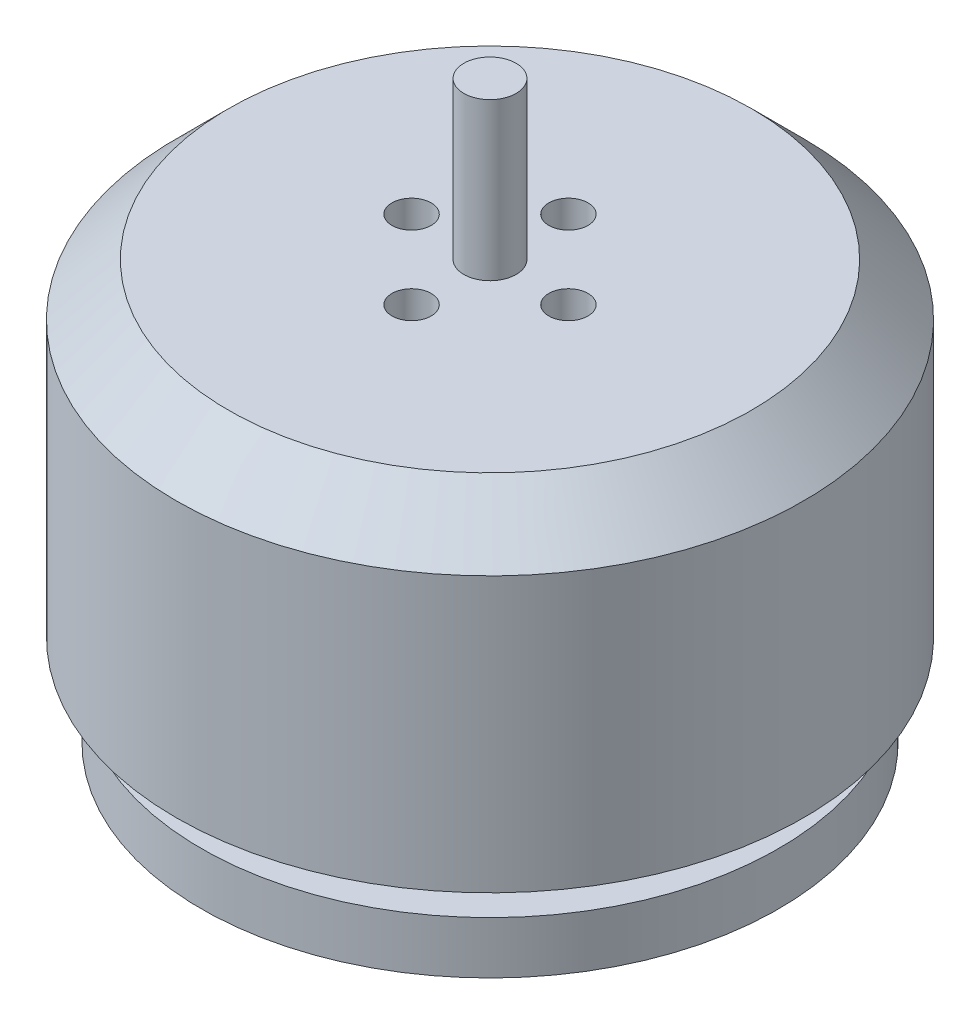
from build123d import *

# Parameters (mm, degrees)
SKETCH2_R          = 1.5
CUT_EXTRUDE1_DEPTH = 3.3
SKETCH3_R          = 1.5
CUT_EXTRUDE2_DEPTH = 8


with BuildPart() as part:
    # Sketch1 → Revolve1 (revolve)
    with BuildSketch(Plane.XY):
        Polygon((0, 0), (22.08, 0), (22.08, 4), (16.8, 4), (16.8, 7), (24, 7), (24, 28), (20, 32), (2, 32), (2, 44), (0, 44), align=None)
    revolve(axis=Axis((0, -10, 0), (0, 1, 0)))

    # Sketch2 → Cut-Extrude1 (cut)
    with BuildSketch(Plane(origin=(0, 0, 0), x_dir=(1, 0, 0), z_dir=(0, 1, 0))):
        with Locations((8.84, -8.84)):
            Circle(SKETCH2_R)
        with Locations((8.84, 8.84)):
            Circle(SKETCH2_R)
        with Locations((-8.84, -8.84)):
            Circle(SKETCH2_R)
        with Locations((-8.84, 8.84)):
            Circle(SKETCH2_R)
    extrude(amount=CUT_EXTRUDE1_DEPTH, mode=Mode.SUBTRACT)

    # Sketch3 → Cut-Extrude2 (cut)
    with BuildSketch(Plane(origin=(0, 32, 0), x_dir=(1, 0, 0), z_dir=(0, 1, 0))):
        with Locations((6, 0)):
            Circle(SKETCH3_R)
        with Locations((-6, 0)):
            Circle(SKETCH3_R)
        with Locations((0, -6)):
            Circle(SKETCH3_R)
        with Locations((0, 6)):
            Circle(SKETCH3_R)
    extrude(amount=-CUT_EXTRUDE2_DEPTH, mode=Mode.SUBTRACT)


solid = part.part
